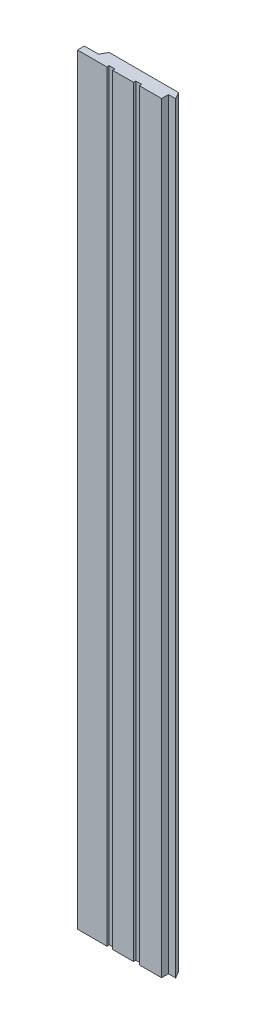
from build123d import *

# Parameters (mm, degrees)
SHAPE_DEPTH = 1000


with BuildPart() as part:
    # Sketch1 → Shape (new body)
    with BuildSketch(Plane(origin=(0, 0, 0), x_dir=(1, 0, 0), z_dir=(0, 1, 0))):
        Polygon((-41.5, 0), (-60, 0), (-60, -9), (-21.25, -9), (-21.25, -6), (-13.75, -6), (-13.75, -9), (13.75, -9), (13.75, -6), (21.25, -6), (21.25, -9), (50.5, -9), (50.5, 0), (60, 0), (54.803847577, 9), (-36.303847577, 9), align=None)
    extrude(amount=SHAPE_DEPTH)


solid = part.part
